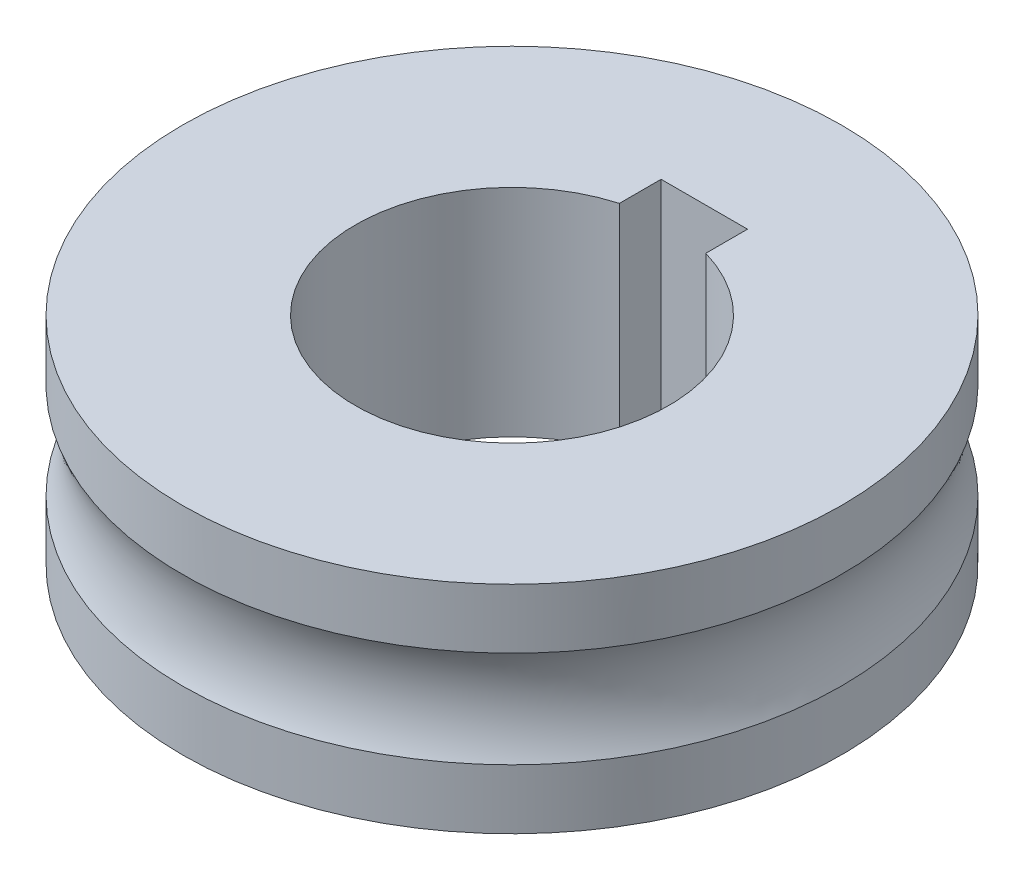
from build123d import *

# Parameters (mm, degrees)
SKETCH_1_R      = 30.5
EXTRUDE_1_DEPTH = 20
SKETCH_2_R      = 10.5


with BuildPart() as part:
    # 草图1 → 凸台-拉伸1 (new body)
    with BuildSketch(Plane(origin=(0, 0, 0), x_dir=(1, 0, 0), z_dir=(0, 1, 0))):
        Circle(SKETCH_1_R)
        with BuildLine():
            Line((-4, 17.8), (-4, 13.937359865))
            ThreePointArc((-4, 13.937359865), (0, -14.5), (4, 13.937359865))
            Line((4, 13.937359865), (4, 17.8))
            Line((4, 17.8), (-4, 17.8))
        make_face(mode=Mode.SUBTRACT)
    extrude(amount=EXTRUDE_1_DEPTH)

    # 草图2 → 切除-旋转1 (revolve, cut)
    with BuildSketch(Plane.XY):
        with Locations((-40, 10)):
            Circle(SKETCH_2_R)
    revolve(axis=Axis((0, 0, 0), (0, 1, 0)), mode=Mode.SUBTRACT)


solid = part.part
